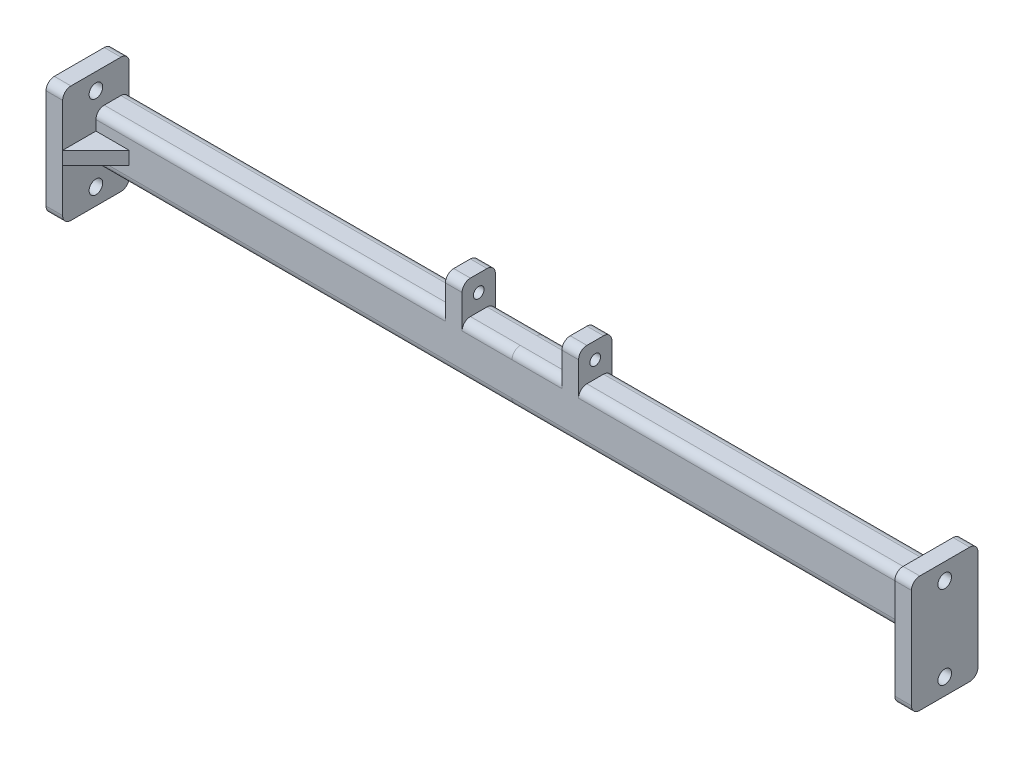
from build123d import *

# Parameters (mm, degrees)
BOSS_EXTRU_1_DEPTH           = 10
BOSS_EXTRU_2_DEPTH           = 10
ESQUISSE4_R                  = 1.6
ENL_V_MAT_EXTRU_1_DEPTH      = 15
ESQUISSE5_R                  = 2.05
ENL_V_MAT_EXTRU_2_DEPTH      = 15
CONG_1_R                     = 2.5
ESQUISSE6_W                  = 10
ESQUISSE6_H                  = 2
BOSS_EXTRU_3_DEPTH           = 10
CHANFREIN1_SIZE              = 10
CONG_1_OF_SYM_TRIE1_R        = 2.5
CHANFREIN1_OF_SYM_TRIE1_SIZE = 10


with BuildPart() as part:
    # Esquisse2 → Boss.-Extru.1 (new body)
    with BuildSketch(Plane.XY):
        Polygon((125, 17.5), (125, 7.5), (20, 7.5), (20, 17.5), (15, 17.5), (15, 7.5), (0, 7.5), (0, -7.5), (125, -7.5), (125, -17.5), (130, -17.5), (130, 17.5), align=None)
    boss_extru_1 = extrude(amount=BOSS_EXTRU_1_DEPTH)

    # Esquisse3 → Boss.-Extru.2 (add)
    with BuildSketch(Plane.XY.offset(10)):
        Polygon((125, 7.5), (125, -7.5), (125, -17.5), (130, -17.5), (130, 17.5), (125, 17.5), align=None)
    boss_extru_2 = extrude(amount=BOSS_EXTRU_2_DEPTH)

    # Esquisse4 → Enlèv. mat.-Extru.1 (cut)
    with BuildSketch(Plane.ZY.offset(-15)):
        with Locations((5, 12.5)):
            Circle(ESQUISSE4_R)
    enl_v_mat_extru_1 = extrude(amount=-ENL_V_MAT_EXTRU_1_DEPTH, mode=Mode.SUBTRACT)

    # Esquisse5 → Enlèv. mat.-Extru.2 (cut)
    with BuildSketch(Plane.ZY.offset(-125)):
        with Locations(Location((10, 12.5, 0), (0, 0, 270))):
            Circle(ESQUISSE5_R)
        with Locations(Location((10, -12.5, 0), (0, 0, 180))):
            Circle(ESQUISSE5_R)
    enl_v_mat_extru_2 = extrude(amount=-ENL_V_MAT_EXTRU_2_DEPTH, mode=Mode.SUBTRACT)

    # Congé1
    cong_1_edges = [part.edges().sort_by_distance(p)[0] for p in [
        (127.5, 17.5, 0),
        (17.5, 17.5, 10),
        (127.5, -17.5, 0),
        (62.5, -7.5, 0),
        (7.5, 7.5, 0),
        (17.5, 17.5, 0),
        (72.5, 7.5, 0),
        (7.5, 7.5, 10),
        (62.5, -7.5, 10),
        (127.5, -17.5, 20),
        (127.5, 17.5, 20),
        (72.5, 7.5, 10),
    ]]
    fillet(cong_1_edges, radius=CONG_1_R)

    # Esquisse6 → Boss.-Extru.3 (add)
    with BuildSketch(Plane.ZY.offset(-125)):
        with Locations((15, 1)):
            Rectangle(ESQUISSE6_W, ESQUISSE6_H)
        with Locations((15, -1)):
            Rectangle(ESQUISSE6_W, ESQUISSE6_H)
    boss_extru_3 = extrude(amount=BOSS_EXTRU_3_DEPTH)

    # Chanfrein1
    chanfrein1_edges = [part.edges().sort_by_distance(p)[0] for p in [
        (115, 0, 20),
    ]]
    chamfer(chanfrein1_edges, length=CHANFREIN1_SIZE - 0.0001)  # a hair under: the kernel refuses the full size

    # Symétrie1: Boss.-Extru.1, Boss.-Extru.2, Enlèv. mat.-Extru.1, Enlèv. mat.-Extru.2, Boss.-Extru.3 across plane
    add(boss_extru_1.mirror(Plane(origin=(0, 0, 0), x_dir=(0, 0, 1), z_dir=(1, 0, 0))))
    add(boss_extru_2.mirror(Plane(origin=(0, 0, 0), x_dir=(0, 0, 1), z_dir=(1, 0, 0))))
    add(enl_v_mat_extru_1.mirror(Plane(origin=(0, 0, 0), x_dir=(0, 0, 1), z_dir=(1, 0, 0))), mode=Mode.SUBTRACT)
    add(enl_v_mat_extru_2.mirror(Plane(origin=(0, 0, 0), x_dir=(0, 0, 1), z_dir=(1, 0, 0))), mode=Mode.SUBTRACT)
    add(boss_extru_3.mirror(Plane(origin=(0, 0, 0), x_dir=(0, 0, 1), z_dir=(1, 0, 0))))

    # Congé1 of Symétrie1
    cong_1_of_sym_trie1_edges = [part.edges().sort_by_distance(p)[0] for p in [
        (-127.5, 17.5, 0),
        (-17.5, 17.5, 10),
        (-127.5, -17.5, 0),
        (-62.5, -7.5, 0),
        (-7.5, 7.5, 0),
        (-17.5, 17.5, 0),
        (-72.5, 7.5, 0),
        (-7.5, 7.5, 10),
        (-62.5, -7.5, 10),
        (-127.5, -17.5, 20),
        (-127.5, 17.5, 20),
        (-72.5, 7.5, 10),
    ]]
    fillet(cong_1_of_sym_trie1_edges, radius=CONG_1_OF_SYM_TRIE1_R)

    # Chanfrein1 of Symétrie1
    chanfrein1_of_sym_trie1_edges = [part.edges().sort_by_distance(p)[0] for p in [
        (-115, 0, 20),
    ]]
    chamfer(chanfrein1_of_sym_trie1_edges, length=CHANFREIN1_OF_SYM_TRIE1_SIZE - 0.0001)  # a hair under: the kernel refuses the full size


solid = part.part
